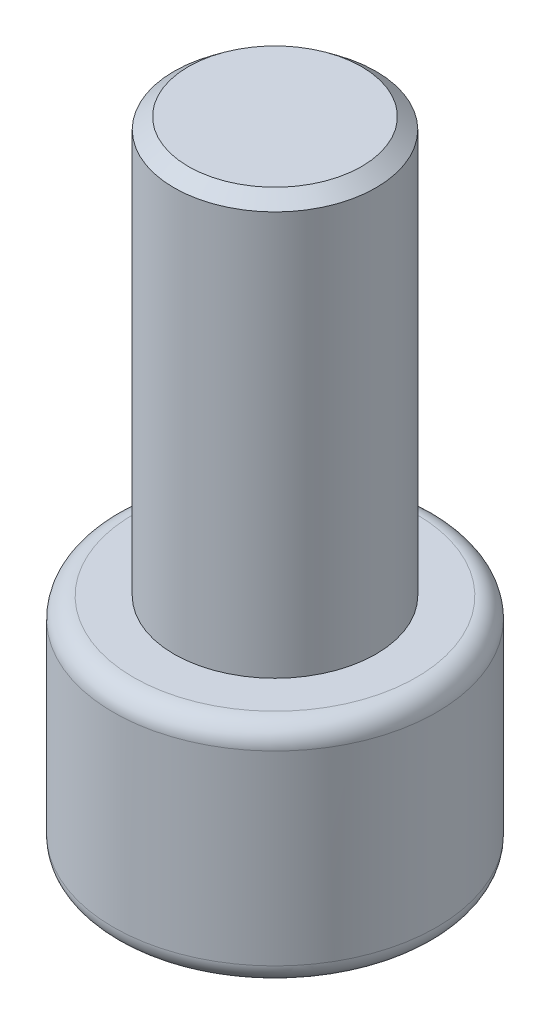
from build123d import *

# Parameters (mm, degrees)
CORTAR_EXTRUIR1_DEPTH = 7
REDONDEO1_R           = 1


with BuildPart() as part:
    # Croquis1 → Revolución2 (revolve)
    with BuildSketch(Plane.XY):
        Polygon((-4.288289157, 31.772433039), (-5, 31.216383588), (-5, 11.216383588), (-8, 11.216383588), (-8, 0), (0, 0), (0, 31.772433039), align=None)
    revolve(axis=Axis((0, 0, 0), (0, 1, 0)))

    # Croquis2 → Cortar-Extruir1 (cut)
    with BuildSketch(Plane.XZ):
        Polygon((0, 5.196152423), (-4.5, 2.598076211), (-4.5, -2.598076211), (0, -5.196152423), (4.5, -2.598076211), (4.5, 2.598076211), align=None)
    extrude(amount=-CORTAR_EXTRUIR1_DEPTH, mode=Mode.SUBTRACT)

    # Redondeo1
    redondeo1_edges = [part.edges().sort_by_distance(p)[0] for p in [
        (8, 0, 0),
        (8, 11.216383588, 0),
    ]]
    fillet(redondeo1_edges, radius=REDONDEO1_R)


solid = part.part
